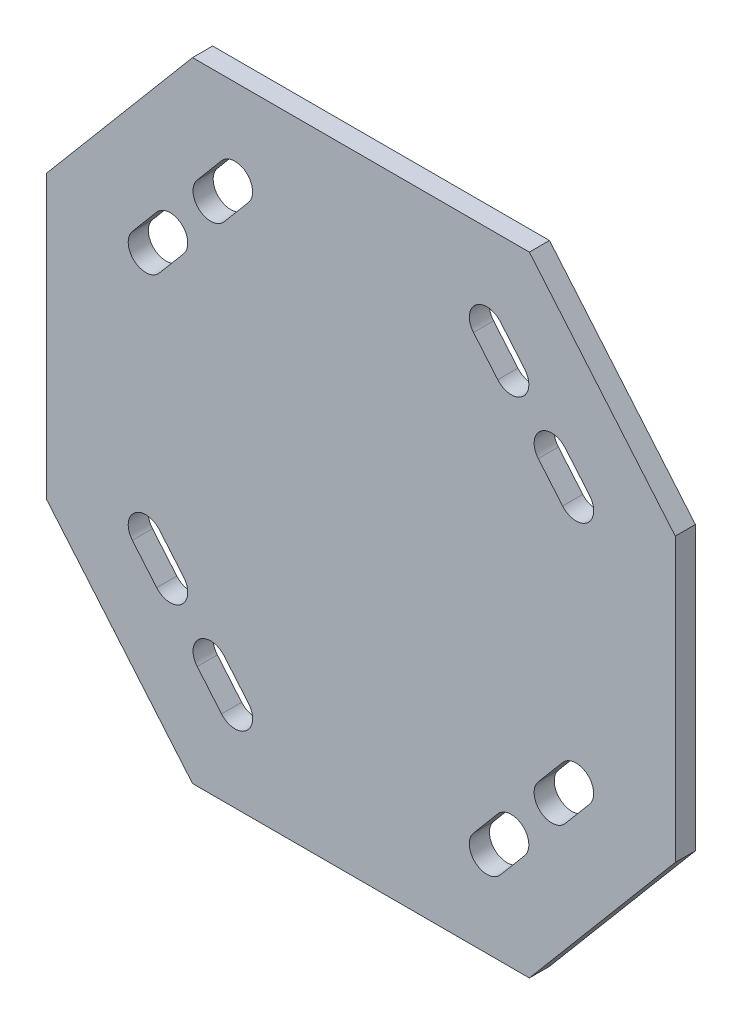
from build123d import *

# Parameters (mm, degrees)
SKETCH_1_W             = 250
SKETCH_1_H             = 250
SM_BASE_FLANGE_1_DEPTH = 8
CUT_EXTRUDE_1_DEPTH    = 10
CUT_EXTRUDE_2_DEPTH    = 10


# Sheet-metal steps are written as plain solids
with BuildPart() as part:
    # Sketch 1 → Базовая кромка1 (new body)
    with BuildSketch(Plane.XY):
        with Locations((125, -125)):
            Rectangle(SKETCH_1_W, SKETCH_1_H)
    extrude(amount=-SM_BASE_FLANGE_1_DEPTH)

    # Sketch 2 → Вырез-Вытянуть1 (cut)
    with BuildSketch(Plane.XY):
        Polygon((58.022064768, 0), (0, -68.8), (0, 0), align=None)
        Polygon((250, 0), (191.977935232, 0), (250, -68.8), align=None)
        Polygon((191.977935232, -250), (250, -181.2), (250, -250), align=None)
        Polygon((0, -250), (58.022064768, -250), (0, -181.2), align=None)
    extrude(amount=-CUT_EXTRUDE_1_DEPTH, mode=Mode.SUBTRACT)

    # Эскиз3 → Вырез-Вытянуть2 (cut)
    with BuildSketch(Plane(origin=(0, 0, -8), x_dir=(-1, 0, 0), z_dir=(0, 0, -1))):
        with BuildLine():
            Line((-69.557250856, -29.753839407), (-59.886906728, -41.220506074))
            ThreePointArc((-59.886906728, -41.220506074), (-60.725190579, -51.084444444), (-70.58912895, -50.246160593))
            Line((-70.58912895, -50.246160593), (-80.259473078, -38.779493926))
            ThreePointArc((-80.259473078, -38.779493926), (-79.421189227, -28.915555556), (-69.557250856, -29.753839407))
        make_face()
        with BuildLine():
            Line((-43.769666514, -60.331617185), (-34.099322386, -71.798283851))
            ThreePointArc((-34.099322386, -71.798283851), (-34.937606238, -81.662222222), (-44.801544609, -80.823938371))
            Line((-44.801544609, -80.823938371), (-54.471888737, -69.357271704))
            ThreePointArc((-54.471888737, -69.357271704), (-53.633604885, -59.493333333), (-43.769666514, -60.331617185))
        make_face()
        with BuildLine():
            Line((-180.442749144, -29.753839407), (-190.113093272, -41.220506074))
            ThreePointArc((-190.113093272, -41.220506074), (-189.274809421, -51.084444444), (-179.41087105, -50.246160593))
            Line((-179.41087105, -50.246160593), (-169.740526922, -38.779493926))
            ThreePointArc((-169.740526922, -38.779493926), (-170.578810773, -28.915555556), (-180.442749144, -29.753839407))
        make_face()
        with BuildLine():
            Line((-206.230333486, -60.331617185), (-215.900677614, -71.798283851))
            ThreePointArc((-215.900677614, -71.798283851), (-215.062393762, -81.662222222), (-205.198455391, -80.823938371))
            Line((-205.198455391, -80.823938371), (-195.528111263, -69.357271704))
            ThreePointArc((-195.528111263, -69.357271704), (-196.366395115, -59.493333333), (-206.230333486, -60.331617185))
        make_face()
        with BuildLine():
            Line((-69.557250856, -220.246160593), (-59.886906728, -208.779493926))
            ThreePointArc((-59.886906728, -208.779493926), (-60.725190579, -198.915555556), (-70.58912895, -199.753839407))
            Line((-70.58912895, -199.753839407), (-80.259473078, -211.220506074))
            ThreePointArc((-80.259473078, -211.220506074), (-79.421189227, -221.084444444), (-69.557250856, -220.246160593))
        make_face()
        with BuildLine():
            Line((-43.769666514, -189.668382815), (-34.099322386, -178.201716149))
            ThreePointArc((-34.099322386, -178.201716149), (-34.937606238, -168.337777778), (-44.801544609, -169.176061629))
            Line((-44.801544609, -169.176061629), (-54.471888737, -180.642728296))
            ThreePointArc((-54.471888737, -180.642728296), (-53.633604885, -190.506666667), (-43.769666514, -189.668382815))
        make_face()
        with BuildLine():
            Line((-180.442749144, -220.246160593), (-190.113093272, -208.779493926))
            ThreePointArc((-190.113093272, -208.779493926), (-189.274809421, -198.915555556), (-179.41087105, -199.753839407))
            Line((-179.41087105, -199.753839407), (-169.740526922, -211.220506074))
            ThreePointArc((-169.740526922, -211.220506074), (-170.578810773, -221.084444444), (-180.442749144, -220.246160593))
        make_face()
        with BuildLine():
            Line((-206.230333486, -189.668382815), (-215.900677614, -178.201716149))
            ThreePointArc((-215.900677614, -178.201716149), (-215.062393762, -168.337777778), (-205.198455391, -169.176061629))
            Line((-205.198455391, -169.176061629), (-195.528111263, -180.642728296))
            ThreePointArc((-195.528111263, -180.642728296), (-196.366395115, -190.506666667), (-206.230333486, -189.668382815))
        make_face()
    extrude(amount=-CUT_EXTRUDE_2_DEPTH, mode=Mode.SUBTRACT)


solid = part.part
